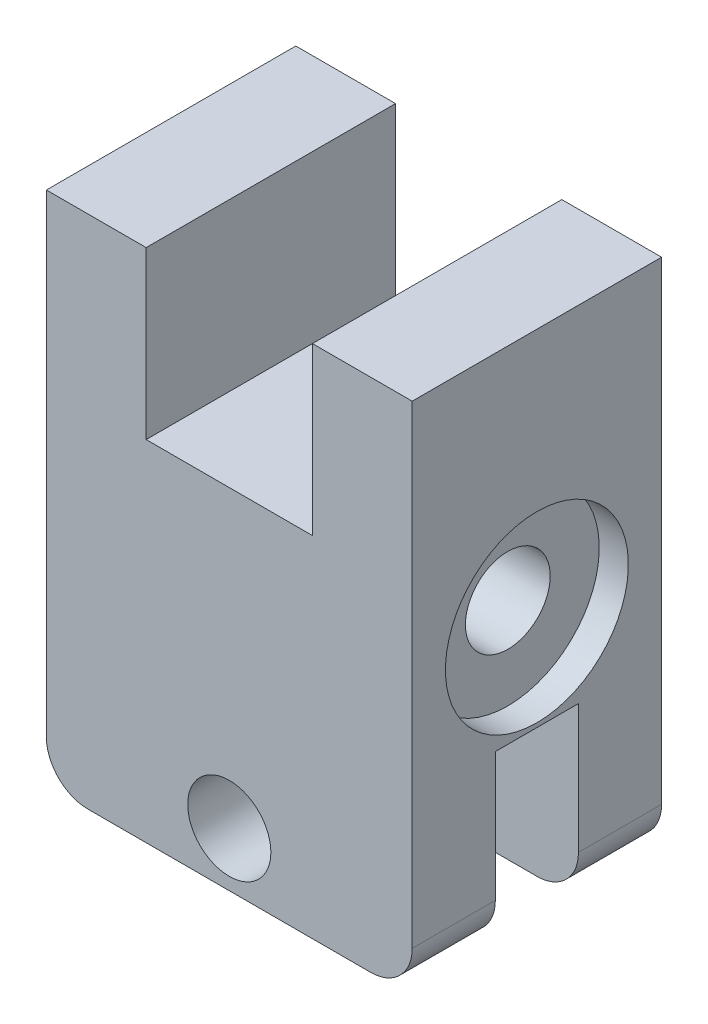
from build123d import *

# Parameters (mm, degrees)
CROQUIS1_R            = 5
BASE_DEPTH            = 30
CROQUIS4_R            = 5.1
CORTAR_EXTRUIR3_DEPTH = 64.725975865
CROQUIS5_R            = 11
CORTAR_EXTRUIR4_DEPTH = 3.5
CROQUIS7_W            = 10
CROQUIS7_H            = 28.5
CORTAR_EXTRUIR6_DEPTH = 64.725975865
CROQUIS8_W            = 44
CROQUIS8_H            = 8
CORTAR_EXTRUIR7_DEPTH = 52.078371156
REDONDEO3_R           = 5


with BuildPart() as part:
    # Croquis1 → Base (new body)
    with BuildSketch(Plane.XY):
        Polygon((-10, 35), (-22, 35), (-22, -35), (22, -35), (22, 35), (10, 35), (10, 15), (-10, 15), align=None)
        with Locations((0, -20.5)):
            Circle(CROQUIS1_R, mode=Mode.SUBTRACT)
    extrude(amount=BASE_DEPTH)

    # Croquis4 → Cortar-Extruir3 (cut, through all)
    with BuildSketch(Plane(origin=(22, 0, 0), x_dir=(0, 0, -1), z_dir=(1, 0, 0))):
        with Locations((-15, 5)):
            Circle(CROQUIS4_R)
    extrude(amount=-CORTAR_EXTRUIR3_DEPTH, mode=Mode.SUBTRACT)

    # Croquis5 → Cortar-Extruir4 (cut)
    with BuildSketch(Plane(origin=(22, 0, 0), x_dir=(0, 0, -1), z_dir=(1, 0, 0))):
        with Locations((-15, 5)):
            Circle(CROQUIS5_R)
    extrude(amount=-CORTAR_EXTRUIR4_DEPTH, mode=Mode.SUBTRACT)

    # Croquis7 → Cortar-Extruir6 (cut, through all)
    with BuildSketch(Plane(origin=(22, 0, 0), x_dir=(0, 0, -1), z_dir=(1, 0, 0))):
        with Locations((-15, -20.75)):
            Rectangle(CROQUIS7_W, CROQUIS7_H)
    extrude(amount=-CORTAR_EXTRUIR6_DEPTH, mode=Mode.SUBTRACT)

    # Croquis8 → Cortar-Extruir7 (cut, through all)
    with BuildSketch(Plane.XY.offset(30)):
        with Locations((0, -31)):
            Rectangle(CROQUIS8_W, CROQUIS8_H)
    extrude(amount=-CORTAR_EXTRUIR7_DEPTH, mode=Mode.SUBTRACT)

    # Redondeo3
    redondeo3_edges = [part.edges().sort_by_distance(p)[0] for p in [
        (-22, -27, 5),
        (-22, -27, 25),
        (22, -27, 5),
        (22, -27, 25),
    ]]
    fillet(redondeo3_edges, radius=REDONDEO3_R)


solid = part.part
